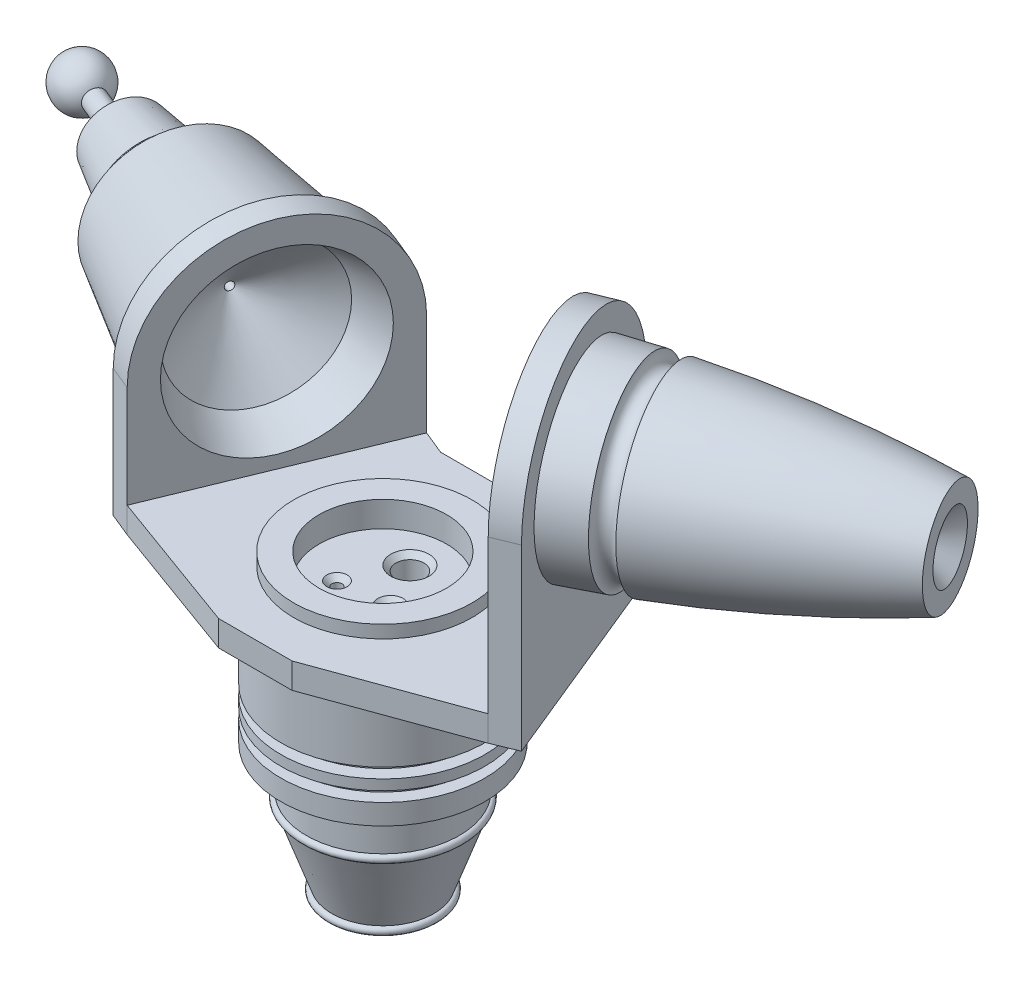
from build123d import *

# Parameters (mm, degrees)
BOSS_EXTRUDE1_DEPTH = 6.35
BOSS_EXTRUDE2_DEPTH = 6.35
BOSS_EXTRUDE3_DEPTH = 6.35
CHAMFER1_SIZE       = 10.418239717
CHAMFER1_SIZE_2     = 6.35
CHAMFER1_SIZE_3     = 5.949478022
SKETCH11_R          = 22.225
BOSS_EXTRUDE4_DEPTH = 3.175
SKETCH12_R          = 15.875
CUT_EXTRUDE2_DEPTH  = 6.35
SKETCH10_R          = 3.4925
SKETCH10_R_2        = 1.905
SKETCH10_R_3        = 1.27
CUT_EXTRUDE1_DEPTH  = 150.554230109
CHAMFER2_SIZE       = 1.27


with BuildPart() as part:
    # Sketch1 → Revolve1 (revolve)
    with BuildSketch(Plane.XY, mode=Mode.PRIVATE) as revolve1_sk:
        with BuildLine():
            Line((0, 0), (25.4, 0))
            Line((25.4, 0), (25.4, -19.05))
            Line((25.4, -19.05), (22.225, -19.05))
            Line((22.225, -19.05), (22.225, -21.59))
            Line((22.225, -21.59), (25.4, -21.59))
            Line((25.4, -21.59), (25.4, -24.13))
            Line((25.4, -24.13), (22.225, -24.13))
            Line((22.225, -24.13), (22.225, -26.67))
            Line((22.225, -26.67), (25.4, -26.67))
            Line((25.4, -26.67), (25.4, -31.75))
            Line((25.4, -31.75), (19.05, -31.75))
            Line((19.05, -31.75), (19.05, -42.2275))
            ThreePointArc((19.05, -42.2275), (20.0025, -43.18), (19.05, -44.1325))
            Line((19.05, -44.1325), (12.7, -62.23))
            ThreePointArc((12.7, -62.23), (13.6525, -63.1825), (12.7, -64.135))
            Line((12.7, -64.135), (0, -64.135))
            Line((0, -64.135), (0, 0))
        make_face()
    revolve(revolve1_sk.sketch.rotate(Axis((0, -64.135, 0), (0, 1, 0)), 90), axis=Axis((0, -64.135, 0), (0, 1, 0)))

    # Sketch2 → Boss-Extrude1 (add)
    with BuildSketch(Plane(origin=(0, 0, 0), x_dir=(1, 0, 0), z_dir=(0, 1, 0))):
        Polygon((-17.390495368, 31.75), (17.390495368, 31.75), (23.265825689, 34.158940351), (44.946288852, -18.719032539), (9.144, -31.75), (-9.144, -31.75), (-44.946288852, -18.719032539), (-23.265825689, 34.158940351), align=None)
    extrude(amount=BOSS_EXTRUDE1_DEPTH)

    # Sketch3 → Boss-Extrude2 (add)
    with BuildSketch(Plane(origin=(31.907427414, 0, -13.082343495), x_dir=(-0.37936068526822037, 0, -0.9252488694793559), z_dir=(0.9252488694793559, 0, -0.37936068526822037))):
        with BuildLine():
            Line((-34.370618634, 44.45), (-34.370618634, 0))
            Line((-34.370618634, 0), (22.779381366, 0))
            Line((22.779381366, 0), (22.779381366, 44.45))
            ThreePointArc((22.779381366, 44.45), (-5.795618634, 73.025), (-34.370618634, 44.45))
        make_face()
    extrude(amount=BOSS_EXTRUDE2_DEPTH)

    # Sketch4 → Boss-Extrude3 (add)
    with BuildSketch(Plane(origin=(-31.907427414, 0, -13.082343495), x_dir=(-0.3793606852682203, 0, 0.9252488694793559), z_dir=(-0.9252488694793559, 0, -0.3793606852682203))):
        with BuildLine():
            Line((34.370618634, 0), (34.370618634, 31.75))
            ThreePointArc((34.370618634, 31.75), (5.795618634, 60.325), (-22.779381366, 31.75))
            Line((-22.779381366, 31.75), (-22.779381366, 0))
            Line((-22.779381366, 0), (34.370618634, 0))
        make_face()
    extrude(amount=BOSS_EXTRUDE3_DEPTH)

    # Sketch6 → Revolve2 (revolve)
    with BuildSketch(Plane(origin=(2.198629856, 0, 5.362389589), x_dir=(0.9252488694793561, 0, -0.37936068526822003), z_dir=(0.37936068526822003, 0, 0.9252488694793563)), mode=Mode.PRIVATE) as revolve2_sk:
        with BuildLine():
            Line((110.685237936, 46.355), (110.685237936, 57.15))
            ThreePointArc((110.685237936, 57.15), (83.574766362, 62.951612182), (56.067426717, 66.413206982))
            ThreePointArc((56.067426717, 66.413206982), (53.34612195, 64.079304761), (51.001565892, 66.791436046))
            ThreePointArc((51.001565892, 66.791436046), (45.920439536, 67.090665137), (40.835237936, 67.31))
            Line((40.835237936, 67.31), (40.835237936, 64.77))
            ThreePointArc((40.835237936, 64.77), (53.139077963, 60.621515717), (60.419070847, 49.869952813))
            Line((60.419070847, 49.869952813), (110.685237936, 46.355))
        make_face()
    revolve(revolve2_sk.sketch.rotate(Axis((39.981387592, 44.45, -10.128894258), (0.9252488694793561, 0, -0.37936068526822)), 90), axis=Axis((39.981387592, 44.45, -10.128894258), (0.9252488694793561, 0, -0.37936068526822)))

    # Sketch7 → Cut-Revolve1 (revolve, cut)
    with BuildSketch(Plane(origin=(2.198629856, 0, 5.362389589), x_dir=(0.9252488694793561, 0, -0.37936068526822003), z_dir=(0.37936068526822003, 0, 0.9252488694793563)), mode=Mode.PRIVATE) as cut_revolve1_sk:
        with BuildLine():
            Line((110.685237936, 44.45), (34.485237936, 44.45))
            Line((34.485237936, 44.45), (34.485237936, 64.77))
            ThreePointArc((34.485237936, 64.77), (46.600514797, 60.763260452), (53.937961055, 50.323156159))
            Line((53.937961055, 50.323156159), (110.685237936, 46.355))
            Line((110.685237936, 46.355), (110.685237936, 44.45))
        make_face()
    revolve(cut_revolve1_sk.sketch.rotate(Axis((104.610021125, 44.45, -36.627238124), (-0.9252488694793561, 0, 0.37936068526822)), 270), axis=Axis((104.610021125, 44.45, -36.627238124), (-0.9252488694793561, 0, 0.37936068526822)), mode=Mode.SUBTRACT)

    # Chamfer1
    # the kernel refuses this chamfer: 10.418239717, 6.35, 5.949478022 mm, written as the material it takes off along each edge
    with BuildSketch(Plane(origin=(58.101306853, 44.45, -17.558230531), x_dir=(0.3793606852682194, -1.3109758705645162e-15, 0.9252488694793563), z_dir=(0, 1, 0))) as chamfer1_piece_1:
        with BuildLine():
            Line((12.679141411, -3.70486024), (5.419952813 - CHAMFER1_SIZE * 0.0697564737426, CHAMFER1_SIZE * 0.997564050239))
            Line((5.419952813 - CHAMFER1_SIZE * 0.0697564737426, CHAMFER1_SIZE * 0.997564050239), (5.419952813, 0))
            ThreePointArc((5.419952813, 0), (9.395846761, -1.566606054), (12.679141411, -3.70486024))
        make_face()
    revolve(axis=Axis((58.101306853, 44.45, -17.558230531), (0.9252488694793561, 0, -0.37936068526822)), mode=Mode.SUBTRACT)
    with BuildSketch(Plane(origin=(104.610021125, 44.45, -36.627238124), x_dir=(0.37936068526821753, 0, 0.9252488694793571), z_dir=(0, 1, 0))) as chamfer1_piece_2:
        Polygon((1.905 + CHAMFER1_SIZE_2 * 0.0697564737441, -CHAMFER1_SIZE_2 * 0.99756405026), (1.905 + CHAMFER1_SIZE_3, 0), (1.905, 0), align=None)
    revolve(axis=Axis((104.610021125, 44.45, -36.627238124), (0.9252488694793561, 0, -0.37936068526822)), mode=Mode.SUBTRACT)

    # Sketch8 → Revolve3 (revolve)
    with BuildSketch(Plane(origin=(-2.198629856, 0, 5.362389589), x_dir=(-0.9252488694793564, 0, -0.37936068526821937), z_dir=(0.37936068526821937, 0, -0.9252488694793564)), mode=Mode.PRIVATE) as revolve3_sk:
        with BuildLine():
            Line((40.835237936, 57.15), (78.935237936, 51.115552824))
            Line((78.935237936, 51.115552824), (78.935237936, 48.895))
            Line((78.935237936, 48.895), (82.110237936, 48.392129402))
            Line((82.110237936, 48.392129402), (82.110237936, 46.355))
            Line((82.110237936, 46.355), (85.285237936, 45.847))
            Line((85.285237936, 45.847), (85.285237936, 43.815))
            Line((85.285237936, 43.815), (104.335237936, 40.7162))
            Line((104.335237936, 40.7162), (104.335237936, 34.29))
            Line((104.335237936, 34.29), (117.565366803, 34.29))
            ThreePointArc((117.565366803, 34.29), (124.682604173, 37.966055087), (129.735237936, 31.75))
            Line((129.735237936, 31.75), (123.385237936, 31.75))
            Line((123.385237936, 31.75), (40.835237936, 31.75))
            Line((40.835237936, 31.75), (40.835237936, 57.15))
        make_face()
    revolve(revolve3_sk.sketch.rotate(Axis((-116.360681767, 31.75, -41.445118826), (0.9252488694793564, 0, 0.3793606852682194)), 90), axis=Axis((-116.360681767, 31.75, -41.445118826), (0.9252488694793564, 0, 0.3793606852682194)))

    # Sketch9 → Cut-Revolve2 (revolve, cut)
    with BuildSketch(Plane(origin=(-2.198629856, 0, 5.362389589), x_dir=(-0.9252488694793564, 0, -0.37936068526821937), z_dir=(0.37936068526821937, 0, -0.9252488694793564)), mode=Mode.PRIVATE) as cut_revolve2_sk:
        Polygon((34.485237936, 53.975), (44.010237936, 49.996605701), (56.075237936, 32.766), (129.735237936, 32.766), (129.735237936, 31.75), (34.485237936, 31.75), align=None)
    revolve(cut_revolve2_sk.sketch.rotate(Axis((-122.236012088, 31.75, -43.854059178), (0.9252488694793564, 0, 0.37936068526821937)), 180), axis=Axis((-122.236012088, 31.75, -43.854059178), (0.9252488694793564, 0, 0.37936068526821937)), mode=Mode.SUBTRACT)

    # Sketch11 → Boss-Extrude4 (add)
    with BuildSketch(Plane(origin=(0, 6.35, 0), x_dir=(1, 0, 0), z_dir=(0, 1, 0))):
        with Locations(Location((0, 0, 0), (0, 0, 90))):
            Circle(SKETCH11_R)
    extrude(amount=BOSS_EXTRUDE4_DEPTH)

    # Sketch12 → Cut-Extrude2 (cut)
    with BuildSketch(Plane(origin=(0, 9.525, 0), x_dir=(1, 0, 0), z_dir=(0, 1, 0))):
        with Locations(Location((0, 0, 0), (0, 0, 270))):
            Circle(SKETCH12_R)
    extrude(amount=-CUT_EXTRUDE2_DEPTH, mode=Mode.SUBTRACT)

    # Sketch10 → Cut-Extrude1 (cut, through all)
    with BuildSketch(Plane(origin=(0, 6.35, 0), x_dir=(1, 0, 0), z_dir=(0, 1, 0))):
        with Locations(Location((0, 6.731, 0), (0, 0, 270))):
            Circle(SKETCH10_R)
        with Locations(Location((6.35, -4.445, 0), (0, 0, 270))):
            Circle(SKETCH10_R_2)
        with Locations(Location((-5.715, -5.715, 0), (0, 0, 270))):
            Circle(SKETCH10_R_3)
    extrude(amount=-CUT_EXTRUDE1_DEPTH, mode=Mode.SUBTRACT)

    # Chamfer2
    chamfer2_edges = [part.edges().sort_by_distance(p)[0] for p in [
        (0, 3.175, -10.2235),
        (0, -64.135, -10.2235),
        (6.35, 3.175, 2.54),
        (6.35, -64.135, 2.54),
        (-5.715, 3.175, 4.445),
        (-5.715, -64.135, 4.445),
    ]]
    chamfer(chamfer2_edges, length=CHAMFER2_SIZE)


solid = part.part
